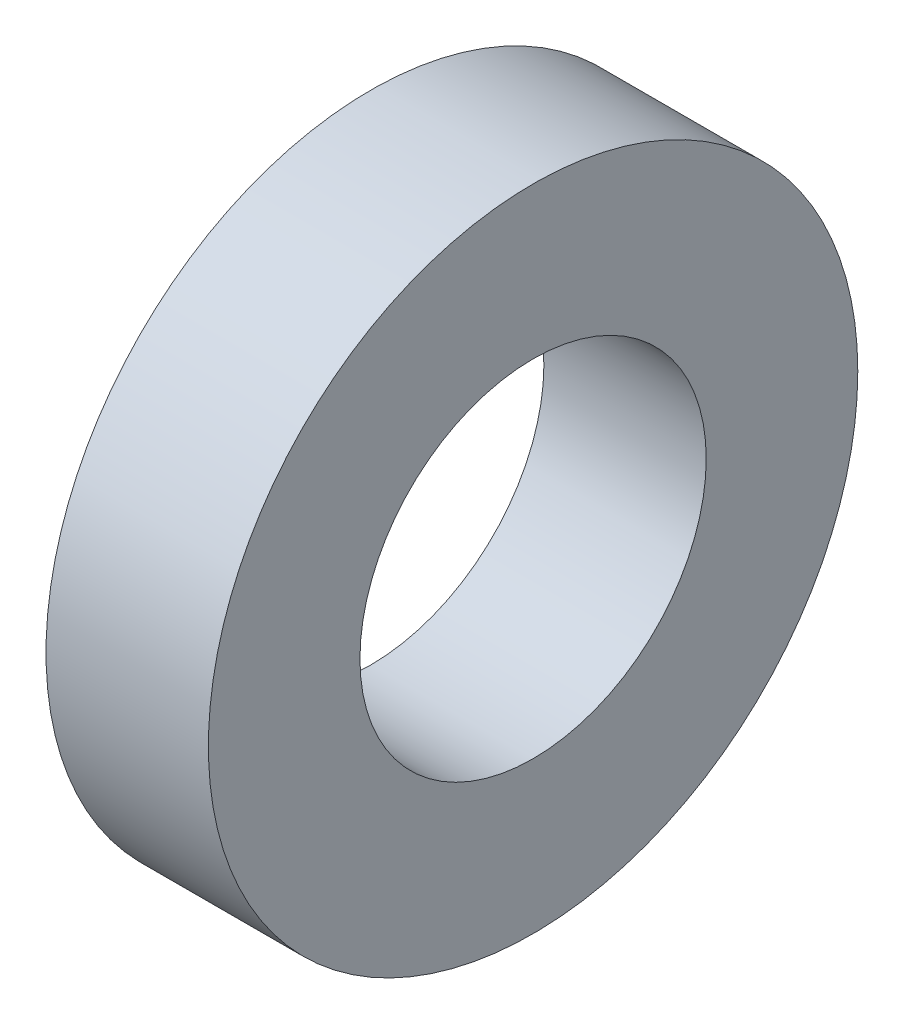
from build123d import *

# Parameters (mm, degrees)
SKETCH1_R           = 12
SKETCH1_R_2         = 6.398731813
BOSS_EXTRUDE1_DEPTH = 6


with BuildPart() as part:
    # Sketch1 → Boss-Extrude1 (new body)
    with BuildSketch(Plane(origin=(0, 0, 0), x_dir=(0, 0, -1), z_dir=(1, 0, 0))):
        Circle(SKETCH1_R)
        Circle(SKETCH1_R_2, mode=Mode.SUBTRACT)
    extrude(amount=BOSS_EXTRUDE1_DEPTH)


solid = part.part
